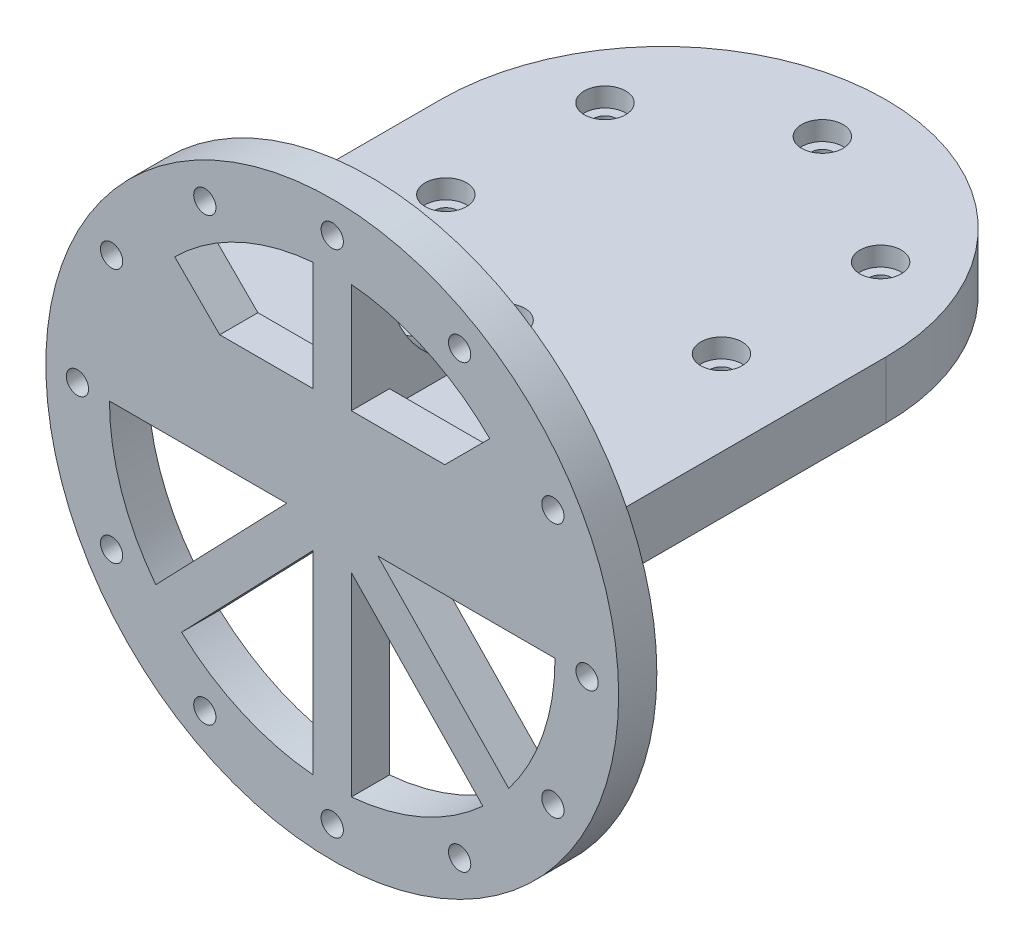
from build123d import *

# Parameters (mm, degrees)
SKETCH1_R                 = 35
BOSS_EXTRUDE1_DEPTH       = 9
SKETCH2_R                 = 30
CUT_EXTRUDE1_DEPTH        = 3
SKETCH3_R                 = 1.75
CUT_EXTRUDE2_DEPTH        = 51.309044912
SKETCH4_R                 = 3.25
CUT_EXTRUDE3_DEPTH        = 3
BOSS_EXTRUDE3_START       = -9
BOSS_EXTRUDE3_DEPTH       = 9
SKETCH21_W                = 70
SKETCH21_H                = 6
BOSS_EXTRUDE8_DEPTH       = 6
SKETCH26_R                = 45
BOSS_EXTRUDE12_DEPTH      = 6
CUT_EXTRUDE20_REACH       = 112.431
SKETCH27_R                = 1.75
SKETCH28_R                = 3.25
CUT_EXTRUDE21_DEPTH       = 3
CUT_EXTRUDE23_DEPTH       = 106.768615383
BOSS_EXTRUDE13_DEPTH      = 3
BOSS_EXTRUDE13_DEPTH_BACK = 3


with BuildPart() as part:
    # Sketch1 → Boss-Extrude1 (new body)
    with BuildSketch(Plane(origin=(0, 0, 0), x_dir=(1, 0, 0), z_dir=(0, 1, 0))):
        Circle(SKETCH1_R)
    extrude(amount=BOSS_EXTRUDE1_DEPTH)

    # Sketch2 → Cut-Extrude1 (cut)
    with BuildSketch(Plane.XZ):
        Circle(SKETCH2_R)
    extrude(amount=-CUT_EXTRUDE1_DEPTH, mode=Mode.SUBTRACT)

    # Sketch3 → Cut-Extrude2 (cut, through all)
    with BuildSketch(Plane(origin=(0, 9, 0), x_dir=(1, 0, 0), z_dir=(0, 1, 0))):
        with Locations((0, -25)):
            Circle(SKETCH3_R)
        with Locations((-21.650635095, -12.5)):
            Circle(SKETCH3_R)
        with Locations((-21.650635095, 12.5)):
            Circle(SKETCH3_R)
        with Locations((0, 25)):
            Circle(SKETCH3_R)
        with Locations((21.650635095, 12.5)):
            Circle(SKETCH3_R)
        with Locations((21.650635095, -12.5)):
            Circle(SKETCH3_R)
    extrude(amount=-CUT_EXTRUDE2_DEPTH, mode=Mode.SUBTRACT)

    # Sketch4 → Cut-Extrude3 (cut)
    with BuildSketch(Plane(origin=(0, 9, 0), x_dir=(1, 0, 0), z_dir=(0, 1, 0))):
        with Locations((0, 25)):
            Circle(SKETCH4_R)
        with Locations((21.650635095, 12.5)):
            Circle(SKETCH4_R)
        with Locations((21.650635095, -12.5)):
            Circle(SKETCH4_R)
        with Locations((0, -25)):
            Circle(SKETCH4_R)
        with Locations((-21.650635095, -12.5)):
            Circle(SKETCH4_R)
        with Locations((-21.650635095, 12.5)):
            Circle(SKETCH4_R)
    extrude(amount=-CUT_EXTRUDE3_DEPTH, mode=Mode.SUBTRACT)

    # Sketch5 → Boss-Extrude3 (add)
    with BuildSketch(Plane(origin=(0, 9, 0), x_dir=(1, 0, 0), z_dir=(0, 1, 0)).offset(BOSS_EXTRUDE3_START)):
        with BuildLine():
            ThreePointArc((35, 0), (0, -35), (-35, 0))
            Line((-35, 0), (-35, -52))
            Line((-35, -52), (35, -52))
            Line((35, -52), (35, 0))
        make_face()
    extrude(amount=BOSS_EXTRUDE3_DEPTH)

    # Sketch21 → Boss-Extrude8 (add)
    with BuildSketch(Plane.XZ):
        with Locations((0, 49)):
            Rectangle(SKETCH21_W, SKETCH21_H)
    extrude(amount=BOSS_EXTRUDE8_DEPTH)

    # Sketch26 → Boss-Extrude12 (add)
    with BuildSketch(Plane.XY.offset(52)):
        with Locations((0, -6)):
            Circle(SKETCH26_R)
    extrude(amount=-BOSS_EXTRUDE12_DEPTH)

    # Sketch27 → Cut-Extrude20 (cut, up to next)
    with BuildSketch(Plane.XY.offset(52), mode=Mode.PRIVATE) as cut_extrude20_sk1:
        with Locations((0, -46.031695342)):
            Circle(SKETCH27_R)
    cut_extrude20_tool1 = extrude(cut_extrude20_sk1.sketch, amount=-CUT_EXTRUDE20_REACH, mode=Mode.PRIVATE) & part.part
    # Sketch27 → Cut-Extrude20 (cut, up to next)
    with BuildSketch(Plane.XY.offset(52), mode=Mode.PRIVATE) as cut_extrude20_sk2:
        with Locations((-20.015847671, -40.668465123)):
            Circle(SKETCH27_R)
    cut_extrude20_tool2 = extrude(cut_extrude20_sk2.sketch, amount=-CUT_EXTRUDE20_REACH, mode=Mode.PRIVATE) & part.part
    # Sketch27 → Cut-Extrude20 (cut, up to next)
    with BuildSketch(Plane.XY.offset(52), mode=Mode.PRIVATE) as cut_extrude20_sk3:
        with Locations((-34.668465123, -26.015847671)):
            Circle(SKETCH27_R)
    cut_extrude20_tool3 = extrude(cut_extrude20_sk3.sketch, amount=-CUT_EXTRUDE20_REACH, mode=Mode.PRIVATE) & part.part
    # Sketch27 → Cut-Extrude20 (cut, up to next)
    with BuildSketch(Plane.XY.offset(52), mode=Mode.PRIVATE) as cut_extrude20_sk4:
        with Locations((-40.031695342, -6)):
            Circle(SKETCH27_R)
    cut_extrude20_tool4 = extrude(cut_extrude20_sk4.sketch, amount=-CUT_EXTRUDE20_REACH, mode=Mode.PRIVATE) & part.part
    # Sketch27 → Cut-Extrude20 (cut, up to next)
    with BuildSketch(Plane.XY.offset(52), mode=Mode.PRIVATE) as cut_extrude20_sk5:
        with Locations((-34.668465123, 14.015847671)):
            Circle(SKETCH27_R)
    cut_extrude20_tool5 = extrude(cut_extrude20_sk5.sketch, amount=-CUT_EXTRUDE20_REACH, mode=Mode.PRIVATE) & part.part
    # Sketch27 → Cut-Extrude20 (cut, up to next)
    with BuildSketch(Plane.XY.offset(52), mode=Mode.PRIVATE) as cut_extrude20_sk6:
        with Locations((-20.015847671, 28.668465123)):
            Circle(SKETCH27_R)
    cut_extrude20_tool6 = extrude(cut_extrude20_sk6.sketch, amount=-CUT_EXTRUDE20_REACH, mode=Mode.PRIVATE) & part.part
    # Sketch27 → Cut-Extrude20 (cut, up to next)
    with BuildSketch(Plane.XY.offset(52), mode=Mode.PRIVATE) as cut_extrude20_sk7:
        with Locations((0, 34.031695342)):
            Circle(SKETCH27_R)
    cut_extrude20_tool7 = extrude(cut_extrude20_sk7.sketch, amount=-CUT_EXTRUDE20_REACH, mode=Mode.PRIVATE) & part.part
    # Sketch27 → Cut-Extrude20 (cut, up to next)
    with BuildSketch(Plane.XY.offset(52), mode=Mode.PRIVATE) as cut_extrude20_sk8:
        with Locations((20.015847671, 28.668465123)):
            Circle(SKETCH27_R)
    cut_extrude20_tool8 = extrude(cut_extrude20_sk8.sketch, amount=-CUT_EXTRUDE20_REACH, mode=Mode.PRIVATE) & part.part
    # Sketch27 → Cut-Extrude20 (cut, up to next)
    with BuildSketch(Plane.XY.offset(52), mode=Mode.PRIVATE) as cut_extrude20_sk9:
        with Locations((34.668465123, 14.015847671)):
            Circle(SKETCH27_R)
    cut_extrude20_tool9 = extrude(cut_extrude20_sk9.sketch, amount=-CUT_EXTRUDE20_REACH, mode=Mode.PRIVATE) & part.part
    # Sketch27 → Cut-Extrude20 (cut, up to next)
    with BuildSketch(Plane.XY.offset(52), mode=Mode.PRIVATE) as cut_extrude20_sk10:
        with Locations((40.031695342, -6)):
            Circle(SKETCH27_R)
    cut_extrude20_tool10 = extrude(cut_extrude20_sk10.sketch, amount=-CUT_EXTRUDE20_REACH, mode=Mode.PRIVATE) & part.part
    # Sketch27 → Cut-Extrude20 (cut, up to next)
    with BuildSketch(Plane.XY.offset(52), mode=Mode.PRIVATE) as cut_extrude20_sk11:
        with Locations((34.668465123, -26.015847671)):
            Circle(SKETCH27_R)
    cut_extrude20_tool11 = extrude(cut_extrude20_sk11.sketch, amount=-CUT_EXTRUDE20_REACH, mode=Mode.PRIVATE) & part.part
    # Sketch27 → Cut-Extrude20 (cut, up to next)
    with BuildSketch(Plane.XY.offset(52), mode=Mode.PRIVATE) as cut_extrude20_sk12:
        with Locations((20.015847671, -40.668465123)):
            Circle(SKETCH27_R)
    cut_extrude20_tool12 = extrude(cut_extrude20_sk12.sketch, amount=-CUT_EXTRUDE20_REACH, mode=Mode.PRIVATE) & part.part
    add(cut_extrude20_tool1.solids().sort_by_distance((0, -46.031695, 52))[0], mode=Mode.SUBTRACT)
    add(cut_extrude20_tool2.solids().sort_by_distance((-20.015848, -40.668465, 52))[0], mode=Mode.SUBTRACT)
    add(cut_extrude20_tool3.solids().sort_by_distance((-34.668465, -26.015848, 52))[0], mode=Mode.SUBTRACT)
    add(cut_extrude20_tool4.solids().sort_by_distance((-40.031695, -6, 52))[0], mode=Mode.SUBTRACT)
    add(cut_extrude20_tool5.solids().sort_by_distance((-34.668465, 14.015848, 52))[0], mode=Mode.SUBTRACT)
    add(cut_extrude20_tool6.solids().sort_by_distance((-20.015848, 28.668465, 52))[0], mode=Mode.SUBTRACT)
    add(cut_extrude20_tool7.solids().sort_by_distance((0, 34.031695, 52))[0], mode=Mode.SUBTRACT)
    add(cut_extrude20_tool8.solids().sort_by_distance((20.015848, 28.668465, 52))[0], mode=Mode.SUBTRACT)
    add(cut_extrude20_tool9.solids().sort_by_distance((34.668465, 14.015848, 52))[0], mode=Mode.SUBTRACT)
    add(cut_extrude20_tool10.solids().sort_by_distance((40.031695, -6, 52))[0], mode=Mode.SUBTRACT)
    add(cut_extrude20_tool11.solids().sort_by_distance((34.668465, -26.015848, 52))[0], mode=Mode.SUBTRACT)
    add(cut_extrude20_tool12.solids().sort_by_distance((20.015848, -40.668465, 52))[0], mode=Mode.SUBTRACT)

    # Sketch28 → Cut-Extrude21 (cut)
    with BuildSketch(Plane(origin=(0, 0, 46), x_dir=(-1, 0, 0), z_dir=(0, 0, -1))):
        with Locations((0, -46.031695342)):
            Circle(SKETCH28_R)
        with Locations((-20, -40.672711494)):
            Circle(SKETCH28_R)
        with Locations((-34.641016151, -26.031695342)):
            Circle(SKETCH28_R)
        with Locations((-40, -6.031695342)):
            Circle(SKETCH28_R)
        with Locations((-34.641016151, 13.968304658)):
            Circle(SKETCH28_R)
        with Locations((-20, 28.609320809)):
            Circle(SKETCH28_R)
        with Locations((0, 33.968304658)):
            Circle(SKETCH28_R)
        with Locations((20, 28.609320809)):
            Circle(SKETCH28_R)
        with Locations((34.641016151, 13.968304658)):
            Circle(SKETCH28_R)
        with Locations((40, -6.031695342)):
            Circle(SKETCH28_R)
        with Locations((34.641016151, -26.031695342)):
            Circle(SKETCH28_R)
        with Locations((20, -40.672711494)):
            Circle(SKETCH28_R)
    extrude(amount=-CUT_EXTRUDE21_DEPTH, mode=Mode.SUBTRACT)

    # Sketch30 → Cut-Extrude23 (cut, through all)
    with BuildSketch(Plane(origin=(0, 0, 46), x_dir=(-1, 0, 0), z_dir=(0, 0, -1))):
        with BuildLine():
            Line((-3, -10.325026058), (-3, -40.871191548))
            ThreePointArc((-3, -40.871191548), (-14.085565968, -38.040549798), (-23.665962091, -31.786086138))
            Line((-23.665962091, -31.786086138), (-3, -10.325026058))
        make_face()
        with BuildLine():
            Line((3, -10.325026058), (3, -40.871191548))
            ThreePointArc((3, -40.871191548), (14.085565968, -38.040549798), (23.665962091, -31.786086138))
            Line((23.665962091, -31.786086138), (3, -10.325026058))
        make_face()
        with BuildLine():
            Line((-7.164790753, -6), (-35, -6))
            ThreePointArc((-35, -6), (-33.132555391, -17.279794913), (-27.729498669, -27.355910272))
            Line((-27.729498669, -27.355910272), (-7.164790753, -6))
        make_face()
        with BuildLine():
            Line((7.164790753, -6), (35, -6))
            ThreePointArc((35, -6), (33.132555391, -17.279794913), (27.729498669, -27.355910272))
            Line((27.729498669, -27.355910272), (7.164790753, -6))
        make_face()
        with BuildLine():
            Line((-24.748737342, 18.748737342), (-17.67766953, 11.67766953))
            Line((-17.67766953, 11.67766953), (-3, 11.67766953))
            Line((-3, 11.67766953), (-3, 28.871191548))
            ThreePointArc((-3, 28.871191548), (-14.768687342, 25.73146505), (-24.748737342, 18.748737342))
        make_face()
        with BuildLine():
            Line((17.67766953, 11.67766953), (24.748737342, 18.748737342))
            ThreePointArc((24.748737342, 18.748737342), (14.768687342, 25.73146505), (3, 28.871191548))
            Line((3, 28.871191548), (3, 11.67766953))
            Line((3, 11.67766953), (17.67766953, 11.67766953))
        make_face()
    extrude(amount=-CUT_EXTRUDE23_DEPTH, mode=Mode.SUBTRACT)

    # Sketch32 → Boss-Extrude13 (add, two sides: drawn at the far end of the back side and taken through both)
    with BuildSketch(Plane(origin=(0, 0, 0), x_dir=(0, 0, -1), z_dir=(1, 0, 0)).offset(-BOSS_EXTRUDE13_DEPTH_BACK)):
        with BuildLine():
            Line((-31, 9), (-46, 9))
            Line((-46, 9), (-46, 24))
            add(Edge.make_bspline(
                [(-31, 9), (-43, 12), (-46, 24)],
                knots=[0, 0, 0, 1, 1, 1], degree=2))
        make_face()
    extrude(amount=BOSS_EXTRUDE13_DEPTH + BOSS_EXTRUDE13_DEPTH_BACK)


solid = part.part
